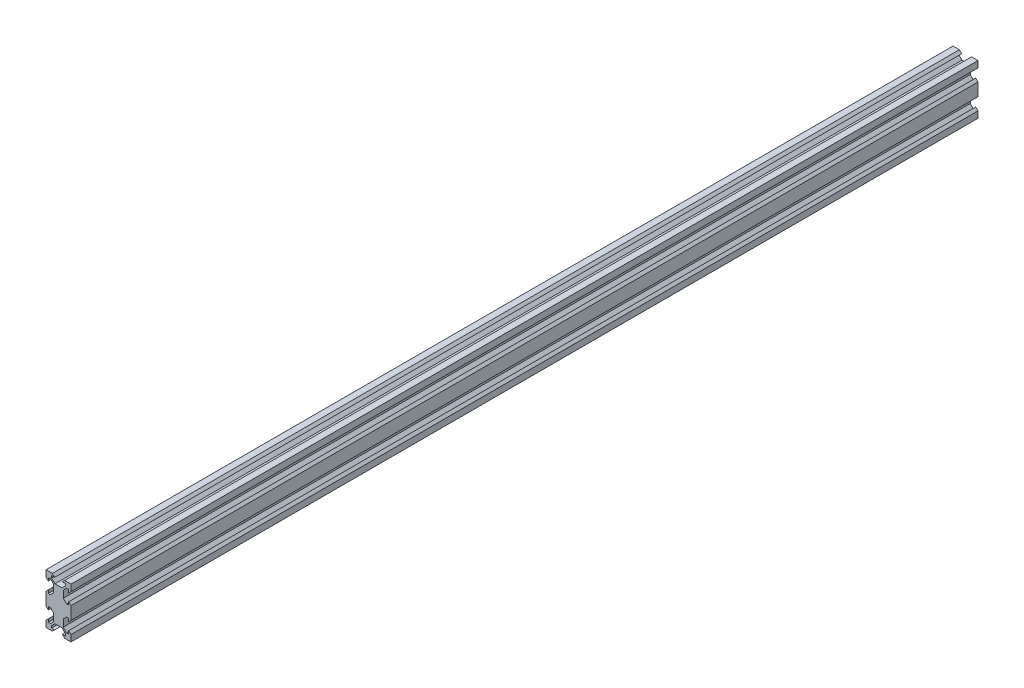
from build123d import *

# Parameters (mm, degrees)
SKETCH1_W           = 20
SKETCH1_H           = 40
BOSS_EXTRUDE1_DEPTH = 725
CUT_EXTRUDE1_DEPTH  = 727.378000768


with BuildPart() as part:
    # Sketch1 → Boss-Extrude1 (new body)
    with BuildSketch(Plane.XY):
        with Locations((10, 20)):
            Rectangle(SKETCH1_W, SKETCH1_H)
    extrude(amount=BOSS_EXTRUDE1_DEPTH)

    # Sketch2 → Cut-Extrude1 (cut, through all)
    with BuildSketch(Plane.XY.offset(725)):
        Polygon((5.12, 40), (6.94, 38.18), (4.5, 38.18), (4.5, 36.475807358), (7.165807358, 33.81), (12.834192642, 33.81), (15.5, 36.475807358), (15.5, 38.18), (13.06, 38.18), (14.88, 40), align=None)
        Polygon((18.18, 35.5), (18.18, 33.06), (20, 34.88), (20, 25.12), (18.18, 26.94), (18.18, 24.5), (16.475807358, 24.5), (13.81, 27.165807358), (13.81, 32.834192642), (16.475807358, 35.5), align=None)
        Polygon((20, 14.88), (18.18, 13.06), (18.18, 15.5), (16.475807358, 15.5), (13.81, 12.834192642), (13.81, 7.165807358), (16.475807358, 4.5), (18.18, 4.5), (18.18, 6.94), (20, 5.12), align=None)
        Polygon((15.5, 1.82), (13.06, 1.82), (14.88, 0), (5.12, 0), (6.94, 1.82), (4.5, 1.82), (4.5, 3.524192642), (7.165807358, 6.19), (12.834192642, 6.19), (15.5, 3.524192642), align=None)
        Polygon((1.82, 4.5), (1.82, 6.94), (0, 5.12), (0, 14.88), (1.82, 13.06), (1.82, 15.5), (3.524192642, 15.5), (6.19, 12.834192642), (6.19, 7.165807358), (3.524192642, 4.5), align=None)
        Polygon((0, 25.12), (1.82, 26.94), (1.82, 24.5), (3.524192642, 24.5), (6.19, 27.165807358), (6.19, 32.834192642), (3.524192642, 35.5), (1.82, 35.5), (1.82, 33.06), (0, 34.88), align=None)
    extrude(amount=-CUT_EXTRUDE1_DEPTH, mode=Mode.SUBTRACT)


solid = part.part
